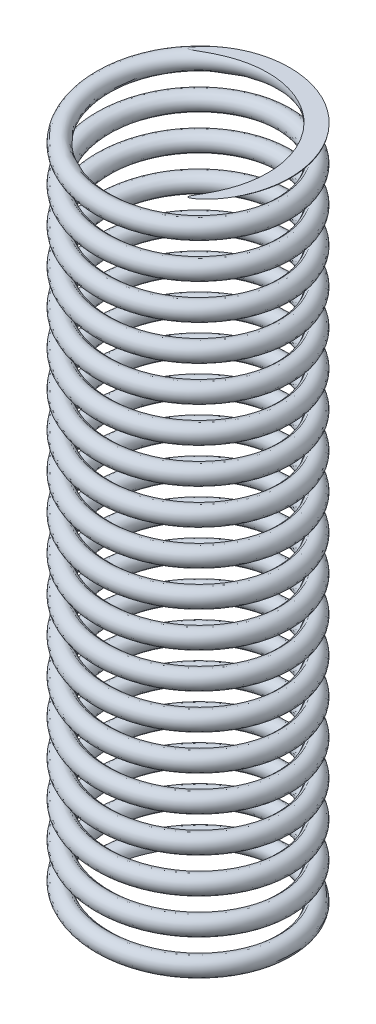
from build123d import *

# Parameters (mm, degrees)
VARREDURA1_PITCH            = 0.8
VARREDURA1_HEIGHT           = 16
VARREDURA1_RADIUS           = 2.05
VARREDURA1_START_ANGLE      = -90
ESBO_O3_R                   = 0.2
CORTE_EXTRUS_O2_START       = 15.5
CORTE_EXTRUS_O2_OUTLINE_W   = 8
CORTE_EXTRUS_O2_OUTLINE_H   = 7
CORTE_EXTRUS_O2_DEPTH       = 0.7
CORTE_EXTRUS_O2_START_2     = -0.2
CORTE_EXTRUS_O2_2_OUTLINE_W = 8
CORTE_EXTRUS_O2_2_OUTLINE_H = 7
CORTE_EXTRUS_O2_2_DEPTH     = 0.2


# Read off the part's stored shape, not the designer's step: Corte-extrusão2
with BuildPart() as part:
    # Varredura1: sweep along a helix
    with BuildLine() as varredura1_path:
        add(Helix(VARREDURA1_PITCH, VARREDURA1_HEIGHT, VARREDURA1_RADIUS, center=(0, 0, 0), direction=(0, 1, 0), lefthand=True, mode=Mode.PRIVATE).rotate(Axis((0, 0, 0), (0, 1, 0)), VARREDURA1_START_ANGLE))
    # Esboço3 → Varredura1 (sweep)
    with BuildSketch(Plane.XY):
        with Locations((-2.05, 0)):
            Circle(ESBO_O3_R)
    sweep(path=varredura1_path.line, is_frenet=True)

    # Corte-extrusão2 outline → Corte-extrusão2 (cut)
    with BuildSketch(Plane(origin=(0, 0, 0), x_dir=(1, 0, 0), z_dir=(0, 1, 0)).offset(CORTE_EXTRUS_O2_START)):
        with Locations((0, 0.5)):
            Rectangle(CORTE_EXTRUS_O2_OUTLINE_W, CORTE_EXTRUS_O2_OUTLINE_H)
    extrude(amount=CORTE_EXTRUS_O2_DEPTH, mode=Mode.SUBTRACT)

    # Corte-extrus_o2 2 outline → Corte-extrus_o2 2 (cut)
    with BuildSketch(Plane(origin=(0, 0, 0), x_dir=(1, 0, 0), z_dir=(0, 1, 0)).offset(CORTE_EXTRUS_O2_START_2)):
        with Locations((0, 0.5)):
            Rectangle(CORTE_EXTRUS_O2_2_OUTLINE_W, CORTE_EXTRUS_O2_2_OUTLINE_H)
    extrude(amount=CORTE_EXTRUS_O2_2_DEPTH, mode=Mode.SUBTRACT)


solid = part.part
